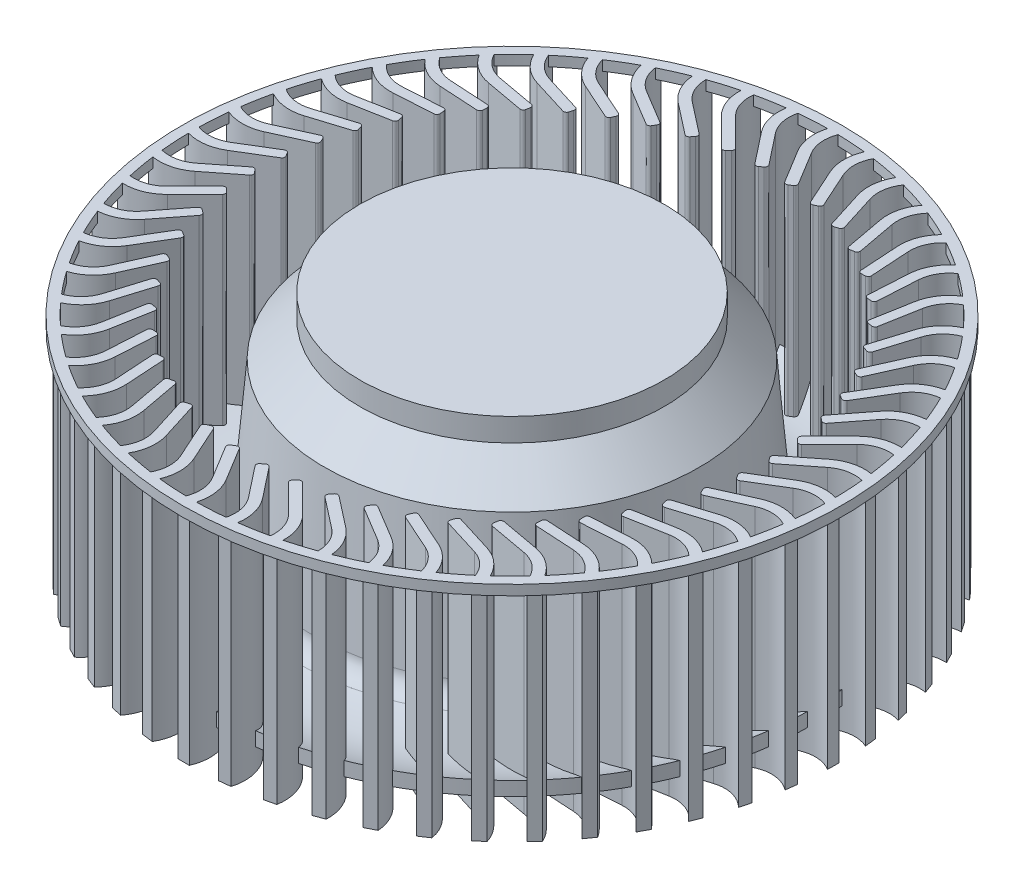
from build123d import *

# Parameters (mm, degrees)
BOSS_EXTRU_1_DEPTH           = 22.6
R_P_TITION_CIRCULAIRE2_COUNT = 52
ESQUISSE6_R                  = 32.9
ESQUISSE6_R_2                = 31.9
BOSS_EXTRU_2_DEPTH           = 1


with BuildPart() as part:
    # Esquisse1 → Révolution1 (revolve)
    with BuildSketch(Plane.XY):
        with BuildLine():
            Line((-15.2, -2.3), (-18.7, -5.8))
            Line((-18.7, -5.8), (-19.890494962, -19.719633397))
            ThreePointArc((-19.890494962, -19.719633397), (-20.333645951, -20.813647486), (-21.316532842, -21.467239859))
            ThreePointArc((-21.316532842, -21.467239859), (-25.698493345, -21.981221323), (-30, -21))
            Line((-30, -21), (-30, -22.397387805))
            ThreePointArc((-30, -22.397387805), (-25.499819297, -23.291262389), (-20.948186126, -22.713963845))
            ThreePointArc((-20.948186126, -22.713963845), (-19.326422757, -21.63553643), (-18.595223624, -19.830413182))
            Line((-18.595223624, -19.830413182), (-17.445171429, -6.38364906))
            Line((-17.445171429, -6.38364906), (-14.509720969, -3.448198601))
            ThreePointArc((-14.509720969, -3.448198601), (-12.546757911, -2.897294162), (-10.562996857, -2.426750063))
            ThreePointArc((-10.562996857, -2.426750063), (-9.69830322, -2.502966982), (-8.928231753, -2.102349909))
            ThreePointArc((-8.928231753, -2.102349909), (-4.482105744, -1.500990837), (0, -1.3))
            Line((0, -1.3), (0, 0))
            Line((0, 0), (-15.2, 0))
            Line((-15.2, 0), (-15.2, -2.3))
        make_face()
    revolve(axis=Axis((0, 0, 0), (0, -1, 0)))

    # Esquisse5 → Boss.-Extru.1 (add)
    with BuildSketch(Plane(origin=(0, -2, 0), x_dir=(1, 0, 0), z_dir=(0, 1, 0))):
        with BuildLine():
            Line((-0.18559172, 25.835702595), (-2.588213297, 28.88704638))
            ThreePointArc((-2.588213297, 28.88704638), (-3.270339018, 30.528785752), (-3, 32.285919919))
            Line((-3, 32.285919919), (-4.111861007, 32.163227824))
            ThreePointArc((-4.111861007, 32.163227824), (-4.219184584, 30.125568618), (-3.373888615, 28.268407314))
            Line((-3.373888615, 28.268407314), (-0.971267038, 25.217063529))
            ThreePointArc((-0.971267038, 25.217063529), (-0.770998182, 25.104755181), (-0.549972723, 25.166952653))
            Line((-0.549972723, 25.166952653), (-0.235702595, 25.41440828))
            ThreePointArc((-0.235702595, 25.41440828), (-0.123394248, 25.614677136), (-0.18559172, 25.835702595))
        make_face()
    boss_extru_1 = extrude(amount=-BOSS_EXTRU_1_DEPTH)

    # Répétition circulaire2: Boss.-Extru.1 ×52 about axis
    r_p_tition_circulaire2_axis = Axis((0, 0, 0), (0, 1, 0))
    for i in range(1, R_P_TITION_CIRCULAIRE2_COUNT):
        add(boss_extru_1.rotate(r_p_tition_circulaire2_axis, i * 360 / R_P_TITION_CIRCULAIRE2_COUNT))

    # Esquisse6 → Boss.-Extru.2 (add)
    with BuildSketch(Plane(origin=(0, -2, 0), x_dir=(1, 0, 0), z_dir=(0, 1, 0))):
        with Locations(Location((0, 0, 0), (0, 0, 270))):
            Circle(ESQUISSE6_R)
        Circle(ESQUISSE6_R_2, mode=Mode.SUBTRACT)
    extrude(amount=-BOSS_EXTRU_2_DEPTH)


solid = part.part
